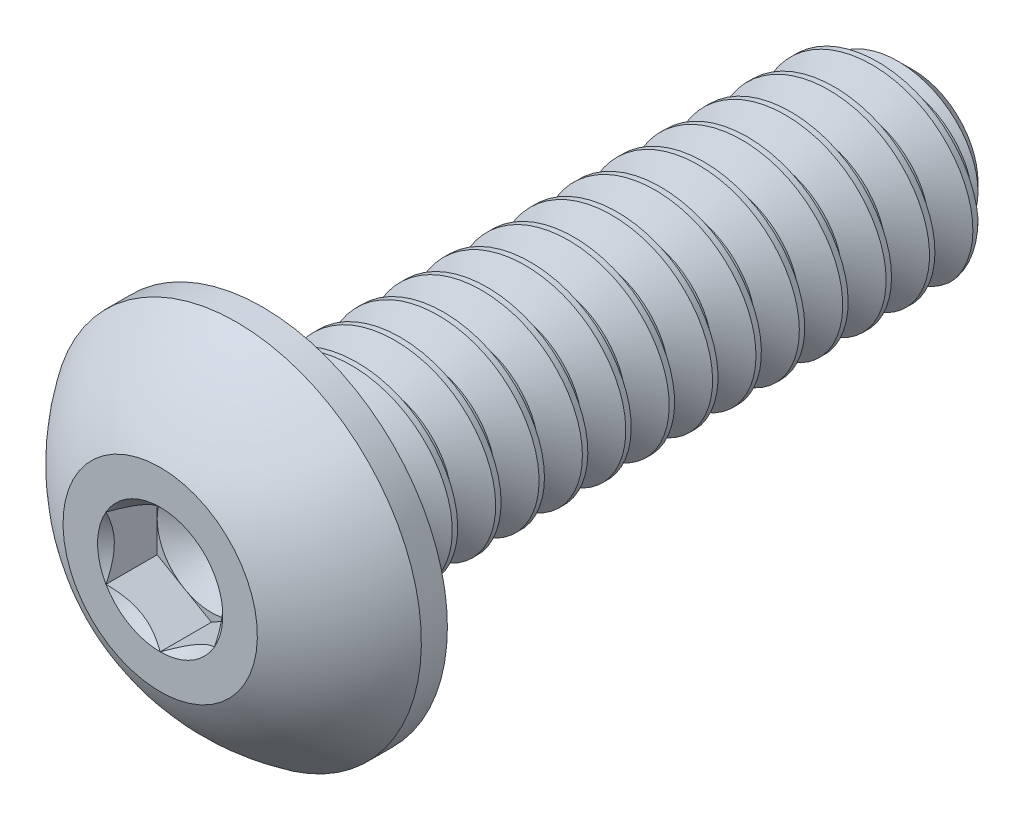
from build123d import *

# Parameters (mm, degrees)
SKETCH1_W          = 9.525
SKETCH1_H          = 1.4224
CHAMFER1_SIZE      = 0.47625
CUT_SWEEP1_PITCH   = 0.635
SKETCH4_R          = 2.7051
EXTRUDE1_DEPTH     = 1.4986
CUT_EXTRUDE1_DEPTH = 0.7493
SKETCH7_R          = 0.916543552
CUT_EXTRUDE4_DEPTH = 0.7493
CUT_EXTRUDE4_DRAFT = -45
SKETCH8_R          = 0.79375
CUT_EXTRUDE5_DEPTH = 0.249766667
CUT_EXTRUDE5_DRAFT = -60


with BuildPart() as part:
    # Sketch1 → Revolve1 (revolve)
    with BuildSketch(Plane(origin=(0, 0, 0), x_dir=(0, 0, -1), z_dir=(1, 0, 0))):
        with Locations((4.7625, 0.7112)):
            Rectangle(SKETCH1_W, SKETCH1_H)
    revolve(axis=Axis((0, 0, 0), (0, 0, 1)))

    # Chamfer1
    chamfer1_edges = [part.edges().sort_by_distance(p)[0] for p in [
        (0, -1.4224, -9.525),
    ]]
    chamfer(chamfer1_edges, length=CHAMFER1_SIZE)

    # Cut-Sweep1: arcs per turn and ends read off the stored shape
    # Cut-Sweep1: the profile of Sketch10 profile screwed along a right-hand helix through 20 turns, 6 arcs to a turn; built about Z, then put on its axis
    cut_sweep1_z = Axis((0, 0, 0), (0, 0, 1))
    cut_sweep1_corners = [(1.4227, 0, -0.079201795), (1.4227, 0, -0.635173205), (1.009955401, 0, -0.396875), (1.009955401, 0, -0.3175)]
    with BuildLine(mode=Mode.PRIVATE) as cut_sweep1_profile:
        Line(cut_sweep1_corners[0], cut_sweep1_corners[1])
        Line(cut_sweep1_corners[1], cut_sweep1_corners[2])
        Line(cut_sweep1_corners[2], cut_sweep1_corners[3])
        Line(cut_sweep1_corners[3], cut_sweep1_corners[0])
    cut_sweep1_cap = Face(cut_sweep1_profile.wire())
    cut_sweep1_turn_angles = [0, 30, 60, 90, 120, 150, 180, 210, 240, 270, 300, 330, 360]
    cut_sweep1_turn_weights = [1, 0.8660254037844387, 1, 0.8660254037844387, 1, 0.8660254037844387, 1, 0.8660254037844387, 1, 0.8660254037844387, 1, 0.8660254037844387, 1]
    cut_sweep1_turn_rails = [Edge.make_bspline([Vector(p[0], p[1], 0).rotate(cut_sweep1_z, cut_sweep1_turn_angles[k]) / cut_sweep1_turn_weights[k] + Vector(0, 0, p[2] + CUT_SWEEP1_PITCH * cut_sweep1_turn_angles[k] / 360) for k in range(13)], [0, 0, 0, 1, 1, 2, 2, 3, 3, 4, 4, 5, 5, 6, 6, 6], 2, cut_sweep1_turn_weights) for p in cut_sweep1_corners]
    cut_sweep1_turn_sides = [Face.make_surface_from_curves(cut_sweep1_turn_rails[p[0]], cut_sweep1_turn_rails[p[1]]) for p in [(0, 1), (1, 2), (2, 3), (3, 0)]]
    cut_sweep1 = Plane(origin=(0, 0, -9.525), x_dir=(0.7071067811865488, 0.7071067811865462, 0), z_dir=(0, 0, 1)) * Solid(Shell([*[p.moved(Location((0, 0, CUT_SWEEP1_PITCH * i))) for i in range(20) for p in cut_sweep1_turn_sides], cut_sweep1_cap, cut_sweep1_cap.rotate(cut_sweep1_z, 7200).moved(Location((0, 0, CUT_SWEEP1_PITCH * 7200 / 360)))]))
    add(cut_sweep1, mode=Mode.SUBTRACT)

    # Sketch4 → Extrude1 (add)
    with BuildSketch(Plane.XY):
        Circle(SKETCH4_R)
    extrude(amount=EXTRUDE1_DEPTH)

    # Sketch9 → Cut-Revolve3 (revolve, cut)
    with BuildSketch(Plane(origin=(0, 0, 0), x_dir=(0, 0, -1), z_dir=(1, 0, 0)), mode=Mode.PRIVATE) as cut_revolve3_sk:
        with BuildLine():
            Line((0, 2.7051), (-0.381, 2.7051))
            ThreePointArc((-0.381, 2.7051), (-1.025093234, 2.138064897), (-1.4986, 1.4224))
            Line((-1.4986, 1.4224), (-1.8796, 1.4224))
            Line((-1.8796, 1.4224), (-1.8796, 3.0861))
            Line((-1.8796, 3.0861), (0, 3.0861))
            Line((0, 3.0861), (0, 2.7051))
        make_face()
    revolve(cut_revolve3_sk.sketch.rotate(Axis((0, 0, 0), (0, 0, 1)), 170.905365297), axis=Axis((0, 0, 0), (0, 0, 1)), mode=Mode.SUBTRACT)

    # Sketch6 → Cut-Extrude1 (cut)
    with BuildSketch(Plane.XY.offset(1.4986)):
        Polygon((0, -0.916543552), (0.79375, -0.458271776), (0.79375, 0.458271776), (0, 0.916543552), (-0.79375, 0.458271776), (-0.79375, -0.458271776), align=None)
    extrude(amount=-CUT_EXTRUDE1_DEPTH, mode=Mode.SUBTRACT)


with BuildPart() as cut_extrude4_tool:
    # Sketch7 → Cut-Extrude4 (with draft: the straight prism first)
    with BuildSketch(Plane.XY.offset(1.4986)):
        Circle(SKETCH7_R)
    extrude(amount=-CUT_EXTRUDE4_DEPTH)
    # Cut-Extrude4: the draft: its side faces are tilted about the plane it starts from
    cut_extrude4_sides = [cut_extrude4_tool.faces().sort_by_distance(p)[0] for p in [
        (-0.916543552, 0, 1.12395),
    ]]
    draft(cut_extrude4_sides, Plane.XY.offset(1.4986), CUT_EXTRUDE4_DRAFT)


with BuildPart() as part_1:
    add(part.part)

    # Cut-Extrude4: cut by cut_extrude4_tool
    add(cut_extrude4_tool.part, mode=Mode.SUBTRACT)


with BuildPart() as cut_extrude5_tool:
    # Sketch8 → Cut-Extrude5 (with draft: the straight prism first)
    with BuildSketch(Plane.XY.offset(0.7493)):
        Circle(SKETCH8_R)
    extrude(amount=-CUT_EXTRUDE5_DEPTH)
    # Cut-Extrude5: the draft: its side faces are tilted about the plane it starts from
    cut_extrude5_sides = [cut_extrude5_tool.faces().sort_by_distance(p)[0] for p in [
        (-0.79375, 0, 0.624416667),
    ]]
    draft(cut_extrude5_sides, Plane.XY.offset(0.7493), CUT_EXTRUDE5_DRAFT)


with BuildPart() as part_2:
    add(part_1.part)

    # Cut-Extrude5: cut by cut_extrude5_tool
    add(cut_extrude5_tool.part, mode=Mode.SUBTRACT)


solid = part_2.part
